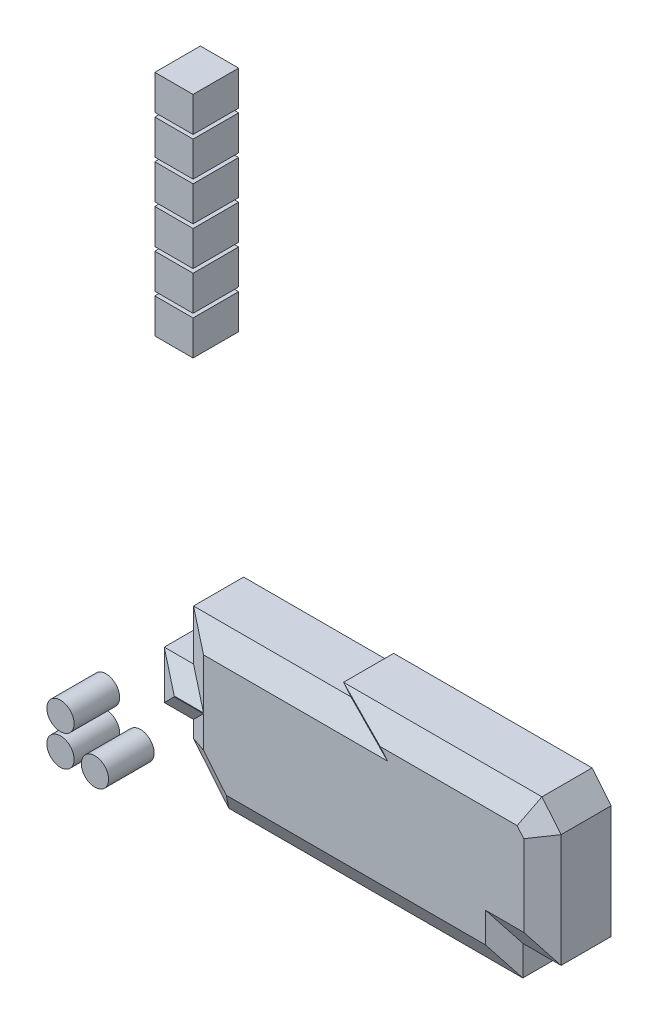
from build123d import *

# Parameters (mm, degrees)
EXTRUDE_1_DEPTH   = 14
SKETCH_2_R        = 3
EXTRUDE_2_DEPTH   = 10
EXTRUDE_2_2_DEPTH = 10
EXTRUDE_2_3_DEPTH = 10
SKETCH_2_W        = 8.399311933
SKETCH_2_H        = 7.623990832
EXTRUDE_2_4_DEPTH = 10
EXTRUDE_2_5_DEPTH = 10
EXTRUDE_2_6_DEPTH = 10
EXTRUDE_2_7_DEPTH = 10
EXTRUDE_2_8_DEPTH = 10
EXTRUDE_2_9_DEPTH = 10


with BuildPart() as part:
    # Эскиз1 → Бобышка-Вытянуть1 (new body)
    with BuildSketch(Plane.XY):
        Polygon((-36.909889511, -38.291088482), (-36.909889511, -49.324157276), (-43.332123585, -49.324157276), (-43.332123585, -59.863208064), (-36.909889511, -59.863208064), (-36.909889511, -63.486006772), (-29.170274088, -72.87234888), (35.381411989, -72.87234888), (35.381411989, -66.285442138), (43.779718086, -66.285442138), (43.779718086, -41.419869184), (39.580565037, -36.327279317), (-3.972709406, -36.327279317), (-2.353428165, -38.291088482), align=None)
    extrude(amount=EXTRUDE_1_DEPTH)

    # Фаска1
    # the kernel refuses this chamfer: 5.196152423, 3 mm, written as the material it takes off along each edge
    with BuildSketch(Plane(origin=(-36.909889511, -49.324157276, 14), x_dir=(0, 0.0578938624026709, -0.9983227437537926), z_dir=(-1, 0, 0)), Plane(origin=(-43.332123585, -59.863208064, 14), x_dir=(0, -0.0578938624026709, -0.9983227437537926), z_dir=(1, 0, 0))) as chamfer_1_piece_1:
        with BuildLine():
            Line((3.109137869, 0), (-0.414994971, 5.361118731))
            Line((-0.414994971, 5.361118731), (-0.518743714, 5.355102224))
            ThreePointArc((-0.518743714, 5.355102224), (-0.259371857, 2.677551112), (-0.103748743, -0.006016507))
            Line((-0.103748743, -0.006016507), (0.006016507, -0.103748743))
            ThreePointArc((0.006016507, -0.103748743), (1.555374994, -0.013899696), (3.115154376, -0.103748743))
            Line((3.115154376, -0.103748743), (3.109137869, 0))
        make_face()
    extrude(amount=6.422234074, mode=Mode.SUBTRACT)
    with BuildSketch(Plane(origin=(-43.332123585, -49.324157276, 14), x_dir=(-0.0578938624026709, 0, -0.9983227437537926), z_dir=(0, -1, 0))) as chamfer_1_piece_2:
        with BuildLine():
            Line((3.109137869, 0), (-0.414994971, 5.361118731))
            Line((-0.414994971, 5.361118731), (-0.518743714, 5.355102224))
            ThreePointArc((-0.518743714, 5.355102224), (-0.259371857, 2.677551112), (-0.103748743, -0.006016507))
            Line((-0.103748743, -0.006016507), (0.006016507, -0.103748743))
            ThreePointArc((0.006016507, -0.103748743), (1.555374994, -0.013899696), (3.115154376, -0.103748743))
            Line((3.115154376, -0.103748743), (3.109137869, 0))
        make_face()
    extrude(amount=10.539050788, mode=Mode.SUBTRACT)
    with BuildSketch(Plane(origin=(-36.909889511, -59.863208064, 14), x_dir=(-0.0578938624026709, 0, -0.9983227437537926), z_dir=(0, -1, 0))) as chamfer_1_piece_3_section:
        with BuildLine():
            Line((3.109137869, 0), (-0.414994971, 5.361118731))
            Line((-0.414994971, 5.361118731), (-0.518743714, 5.355102224))
            ThreePointArc((-0.518743714, 5.355102224), (-0.259371857, 2.677551112), (-0.103748743, -0.006016507))
            Line((-0.103748743, -0.006016507), (0.006016507, -0.103748743))
            ThreePointArc((0.006016507, -0.103748743), (1.555374994, -0.013899696), (3.115154376, -0.103748743))
            Line((3.115154376, -0.103748743), (3.109137869, 0))
        make_face()
    chamfer_1_piece_3 = extrude(amount=17.06569062, mode=Mode.PRIVATE)
    chamfer_1_piece_3 = split(chamfer_1_piece_3, bisect_by=Plane(origin=(-36.310735652, -64.212640175, 13.15573984), z_dir=(0.7715393663129642, 0.6361815827492885, 0)), keep=Keep.TOP, mode=Mode.PRIVATE)
    add(chamfer_1_piece_3, mode=Mode.SUBTRACT)
    with BuildSketch(Plane(origin=(-45.462009764, -53.114286465, 14), x_dir=(-0.04466739391156679, -0.03683100901480082, -0.9983227437537926), z_dir=(0.6361815827492885, -0.7715393663129642, 0))) as chamfer_1_piece_4_section:
        with BuildLine():
            Line((3.109137869, 0), (-0.414994971, 5.361118731))
            Line((-0.414994971, 5.361118731), (-0.518743714, 5.355102224))
            ThreePointArc((-0.518743714, 5.355102224), (-0.259371857, 2.677551112), (-0.103748743, -0.006016507))
            Line((-0.103748743, -0.006016507), (0.006016507, -0.103748743))
            ThreePointArc((0.006016507, -0.103748743), (1.555374994, -0.013899696), (3.115154376, -0.103748743))
            Line((3.115154376, -0.103748743), (3.109137869, 0))
        make_face()
    chamfer_1_piece_4 = extrude(amount=39.051517055, mode=Mode.PRIVATE)
    chamfer_1_piece_4 = split(chamfer_1_piece_4, bisect_by=Plane(origin=(-36.909889511, -66.628217191, 13.110188551), z_dir=(1, 0, 0)), keep=Keep.TOP, mode=Mode.PRIVATE)
    chamfer_1_piece_4 = split(chamfer_1_piece_4, bisect_by=Plane(origin=(-31.761219521, -72.87234888, 13.110188551), z_dir=(0, 1, 0)), keep=Keep.TOP, mode=Mode.PRIVATE)
    add(chamfer_1_piece_4, mode=Mode.SUBTRACT)
    with BuildSketch(Plane(origin=(-42.613166, -72.87234888, 14), x_dir=(0, -0.05789386240267318, -0.9983227437537925), z_dir=(1, 0, 0))) as chamfer_1_piece_5_section:
        with BuildLine():
            Line((3.109137869, 0), (-0.414994971, 5.361118731))
            Line((-0.414994971, 5.361118731), (-0.518743714, 5.355102224))
            ThreePointArc((-0.518743714, 5.355102224), (-0.259371857, 2.677551112), (-0.103748743, -0.006016507))
            Line((-0.103748743, -0.006016507), (0.006016507, -0.103748743))
            ThreePointArc((0.006016507, -0.103748743), (1.555374994, -0.013899696), (3.115154376, -0.103748743))
            Line((3.115154376, -0.103748743), (3.109137869, 0))
        make_face()
    chamfer_1_piece_5 = extrude(amount=77.994577989, mode=Mode.PRIVATE)
    chamfer_1_piece_5 = split(chamfer_1_piece_5, bisect_by=Plane(origin=(-17.2681662, -87.306820149, 13.044949629), z_dir=(0.7715393663129642, 0.6361815827492885, 0)), keep=Keep.TOP, mode=Mode.PRIVATE)
    add(chamfer_1_piece_5, mode=Mode.SUBTRACT)
    with BuildSketch(Plane(origin=(35.381411989, -72.87234888, 14), x_dir=(0.0578938624026709, 0, -0.9983227437537926), z_dir=(0, 1, 0))) as chamfer_1_piece_6:
        with BuildLine():
            Line((3.109137869, 0), (-0.414994971, 5.361118731))
            Line((-0.414994971, 5.361118731), (-0.518743714, 5.355102224))
            ThreePointArc((-0.518743714, 5.355102224), (-0.259371857, 2.677551112), (-0.103748743, -0.006016507))
            Line((-0.103748743, -0.006016507), (0.006016507, -0.103748743))
            ThreePointArc((0.006016507, -0.103748743), (1.555374994, -0.013899696), (3.115154376, -0.103748743))
            Line((3.115154376, -0.103748743), (3.109137869, 0))
        make_face()
    extrude(amount=6.586906743, mode=Mode.SUBTRACT)
    with BuildSketch(Plane(origin=(35.381411989, -66.285442138, 14), x_dir=(0, -0.05789386240267318, -0.9983227437537925), z_dir=(1, 0, 0))) as chamfer_1_piece_7:
        with BuildLine():
            Line((3.109137869, 0), (-0.414994971, 5.361118731))
            Line((-0.414994971, 5.361118731), (-0.518743714, 5.355102224))
            ThreePointArc((-0.518743714, 5.355102224), (-0.259371857, 2.677551112), (-0.103748743, -0.006016507))
            Line((-0.103748743, -0.006016507), (0.006016507, -0.103748743))
            ThreePointArc((0.006016507, -0.103748743), (1.555374994, -0.013899696), (3.115154376, -0.103748743))
            Line((3.115154376, -0.103748743), (3.109137869, 0))
        make_face()
    extrude(amount=8.398306097, mode=Mode.SUBTRACT)
    with BuildSketch(Plane(origin=(43.779718086, -66.285442138, 14), x_dir=(0.0578938624026709, 0, -0.9983227437537926), z_dir=(0, 1, 0))) as chamfer_1_piece_8_section:
        with BuildLine():
            Line((3.109137869, 0), (-0.414994971, 5.361118731))
            Line((-0.414994971, 5.361118731), (-0.518743714, 5.355102224))
            ThreePointArc((-0.518743714, 5.355102224), (-0.259371857, 2.677551112), (-0.103748743, -0.006016507))
            Line((-0.103748743, -0.006016507), (0.006016507, -0.103748743))
            ThreePointArc((0.006016507, -0.103748743), (1.555374994, -0.013899696), (3.115154376, -0.103748743))
            Line((3.115154376, -0.103748743), (3.109137869, 0))
        make_face()
    chamfer_1_piece_8 = extrude(amount=38.308464865, mode=Mode.PRIVATE)
    chamfer_1_piece_8 = split(chamfer_1_piece_8, bisect_by=Plane(origin=(48.602023871, -47.268197478, 13.0630262), z_dir=(-0.7715393663129643, -0.6361815827492884, 0)), keep=Keep.TOP, mode=Mode.PRIVATE)
    add(chamfer_1_piece_8, mode=Mode.SUBTRACT)
    with BuildSketch(Plane(origin=(52.331838339, -51.791589491, 14), x_dir=(0.04466739391156704, 0.036831009014801006, -0.9983227437537926), z_dir=(-0.6361815827492884, 0.7715393663129643, 0))) as chamfer_1_piece_9_section:
        with BuildLine():
            Line((3.109137869, 0), (-0.414994971, 5.361118731))
            Line((-0.414994971, 5.361118731), (-0.518743714, 5.355102224))
            ThreePointArc((-0.518743714, 5.355102224), (-0.259371857, 2.677551112), (-0.103748743, -0.006016507))
            Line((-0.103748743, -0.006016507), (0.006016507, -0.103748743))
            ThreePointArc((0.006016507, -0.103748743), (1.555374994, -0.013899696), (3.115154376, -0.103748743))
            Line((3.115154376, -0.103748743), (3.109137869, 0))
        make_face()
    chamfer_1_piece_9 = extrude(amount=33.486341215, mode=Mode.PRIVATE)
    chamfer_1_piece_9 = split(chamfer_1_piece_9, bisect_by=Plane(origin=(43.779718086, -40.523934217, 13.149770443), z_dir=(-1, 0, 0)), keep=Keep.TOP, mode=Mode.PRIVATE)
    chamfer_1_piece_9 = split(chamfer_1_piece_9, bisect_by=Plane(origin=(40.319318432, -36.327279317, 13.149770443), z_dir=(0, -1, 0)), keep=Keep.TOP, mode=Mode.PRIVATE)
    add(chamfer_1_piece_9, mode=Mode.SUBTRACT)
    with BuildSketch(Plane(origin=(11.089463747, -38.291088482, 14), x_dir=(0, 0.0578938624026709, -0.9983227437537926), z_dir=(-1, 0, 0))) as chamfer_1_piece_10_section:
        with BuildLine():
            Line((3.109137869, 0), (-0.414994971, 5.361118731))
            Line((-0.414994971, 5.361118731), (-0.518743714, 5.355102224))
            ThreePointArc((-0.518743714, 5.355102224), (-0.259371857, 2.677551112), (-0.103748743, -0.006016507))
            Line((-0.103748743, -0.006016507), (0.006016507, -0.103748743))
            ThreePointArc((0.006016507, -0.103748743), (1.555374994, -0.013899696), (3.115154376, -0.103748743))
            Line((3.115154376, -0.103748743), (3.109137869, 0))
        make_face()
    chamfer_1_piece_10 = extrude(amount=47.999353257, mode=Mode.PRIVATE)
    chamfer_1_piece_10 = split(chamfer_1_piece_10, bisect_by=Plane(origin=(-8.173409607, -31.232813116, 13.050749195), z_dir=(-0.7715393663129635, -0.6361815827492894, 0)), keep=Keep.TOP, mode=Mode.PRIVATE)
    add(chamfer_1_piece_10, mode=Mode.SUBTRACT)
    with BuildSketch(Plane(origin=(53.023456949, -36.327279317, 14), x_dir=(0, 0.0578938624026709, -0.9983227437537926), z_dir=(-1, 0, 0))) as chamfer_1_piece_11_section:
        with BuildLine():
            Line((3.109137869, 0), (-0.414994971, 5.361118731))
            Line((-0.414994971, 5.361118731), (-0.518743714, 5.355102224))
            ThreePointArc((-0.518743714, 5.355102224), (-0.259371857, 2.677551112), (-0.103748743, -0.006016507))
            Line((-0.103748743, -0.006016507), (0.006016507, -0.103748743))
            ThreePointArc((0.006016507, -0.103748743), (1.555374994, -0.013899696), (3.115154376, -0.103748743))
            Line((3.115154376, -0.103748743), (3.109137869, 0))
        make_face()
    chamfer_1_piece_11 = extrude(amount=70.439058267, mode=Mode.PRIVATE)
    chamfer_1_piece_11 = split(chamfer_1_piece_11, bisect_by=Plane(origin=(32.203932865, -27.381150939, 13.037990314), z_dir=(-0.7715393663129643, -0.6361815827492884, 0)), keep=Keep.TOP, mode=Mode.PRIVATE)
    chamfer_1_piece_11 = split(chamfer_1_piece_11, bisect_by=Plane(origin=(6.277844799, -48.758802502, 13.037990314), z_dir=(0.7715393663129635, 0.6361815827492894, 0)), keep=Keep.TOP, mode=Mode.PRIVATE)
    add(chamfer_1_piece_11, mode=Mode.SUBTRACT)
    with BuildSketch(Plane(origin=(-12.524829659, -25.95555901, 14), x_dir=(-0.04466739391156709, -0.03683100901480115, -0.9983227437537926), z_dir=(0.6361815827492894, -0.7715393663129635, 0))) as chamfer_1_piece_12_section:
        with BuildLine():
            Line((3.109137869, 0), (-0.414994971, 5.361118731))
            Line((-0.414994971, 5.361118731), (-0.518743714, 5.355102224))
            ThreePointArc((-0.518743714, 5.355102224), (-0.259371857, 2.677551112), (-0.103748743, -0.006016507))
            Line((-0.103748743, -0.006016507), (0.006016507, -0.103748743))
            ThreePointArc((0.006016507, -0.103748743), (1.555374994, -0.013899696), (3.115154376, -0.103748743))
            Line((3.115154376, -0.103748743), (3.109137869, 0))
        make_face()
    chamfer_1_piece_12 = extrude(amount=29.431096805, mode=Mode.PRIVATE)
    chamfer_1_piece_12 = split(chamfer_1_piece_12, bisect_by=Plane(origin=(-6.345177041, -38.291088482, 13.06885324), z_dir=(0, 1, 0)), keep=Keep.TOP, mode=Mode.PRIVATE)
    add(chamfer_1_piece_12, mode=Mode.SUBTRACT)
    with BuildSketch(Plane(origin=(-36.909889511, -38.291088482, 14), x_dir=(-0.0578938624026709, 0, -0.9983227437537926), z_dir=(0, -1, 0))) as chamfer_1_piece_13:
        with BuildLine():
            Line((3.109137869, 0), (-0.414994971, 5.361118731))
            Line((-0.414994971, 5.361118731), (-0.518743714, 5.355102224))
            ThreePointArc((-0.518743714, 5.355102224), (-0.259371857, 2.677551112), (-0.103748743, -0.006016507))
            Line((-0.103748743, -0.006016507), (0.006016507, -0.103748743))
            ThreePointArc((0.006016507, -0.103748743), (1.555374994, -0.013899696), (3.115154376, -0.103748743))
            Line((3.115154376, -0.103748743), (3.109137869, 0))
        make_face()
    extrude(amount=11.033068794, mode=Mode.SUBTRACT)
    with BuildSketch(Plane(origin=(-36.909889511, -38.291088482, 14), x_dir=(-0.0578938624026709, 0, -0.9983227437537926), z_dir=(0, -1, 0))) as chamfer_1_piece_14a_section:
        with BuildLine():
            Line((3.109137869, 0), (-0.414994971, 5.361118731))
            Line((-0.414994971, 5.361118731), (-0.518743714, 5.355102224))
            ThreePointArc((-0.518743714, 5.355102224), (-0.259371857, 2.677551112), (-0.103748743, -0.006016507))
            Line((-0.103748743, -0.006016507), (0.006016507, -0.103748743))
            ThreePointArc((0.006016507, -0.103748743), (1.555374994, -0.013899696), (3.115154376, -0.103748743))
            Line((3.115154376, -0.103748743), (3.109137869, 0))
        make_face()
    chamfer_1_piece_14a = extrude(amount=24.475960706, mode=Mode.PRIVATE)
    chamfer_1_piece_14a = split(chamfer_1_piece_14a, bisect_by=Plane(origin=(-35.167192108, -49.324157276, 13.037990314), z_dir=(0, -1, 0)), keep=Keep.TOP, mode=Mode.PRIVATE)
    with BuildSketch(Plane(origin=(-23.466997599, -49.324157276, 14), x_dir=(0, 0.0578938624026709, -0.9983227437537926), z_dir=(-1, 0, 0))) as chamfer_1_piece_14b_section:
        with BuildLine():
            Line((3.109137869, 0), (-0.414994971, 5.361118731))
            Line((-0.414994971, 5.361118731), (-0.518743714, 5.355102224))
            ThreePointArc((-0.518743714, 5.355102224), (-0.259371857, 2.677551112), (-0.103748743, -0.006016507))
            Line((-0.103748743, -0.006016507), (0.006016507, -0.103748743))
            ThreePointArc((0.006016507, -0.103748743), (1.555374994, -0.013899696), (3.115154376, -0.103748743))
            Line((3.115154376, -0.103748743), (3.109137869, 0))
        make_face()
    chamfer_1_piece_14b = extrude(amount=19.865125986, mode=Mode.PRIVATE)
    chamfer_1_piece_14b = split(chamfer_1_piece_14b, bisect_by=Plane(origin=(-36.909889511, -51.066854679, 13.037990314), z_dir=(1, 0, 0)), keep=Keep.TOP, mode=Mode.PRIVATE)
    chamfer_1_piece_14 = chamfer_1_piece_14a & chamfer_1_piece_14b
    add(chamfer_1_piece_14, mode=Mode.SUBTRACT)
    with BuildSketch(Plane(origin=(-36.909889511, -49.324157276, 14), x_dir=(0, 0.0578938624026709, -0.9983227437537926), z_dir=(-1, 0, 0))) as chamfer_1_piece_15a_section:
        with BuildLine():
            Line((3.109137869, 0), (-0.414994971, 5.361118731))
            Line((-0.414994971, 5.361118731), (-0.518743714, 5.355102224))
            ThreePointArc((-0.518743714, 5.355102224), (-0.259371857, 2.677551112), (-0.103748743, -0.006016507))
            Line((-0.103748743, -0.006016507), (0.006016507, -0.103748743))
            ThreePointArc((0.006016507, -0.103748743), (1.555374994, -0.013899696), (3.115154376, -0.103748743))
            Line((3.115154376, -0.103748743), (3.109137869, 0))
        make_face()
    chamfer_1_piece_15a = extrude(amount=19.865125986, mode=Mode.PRIVATE)
    chamfer_1_piece_15a = split(chamfer_1_piece_15a, bisect_by=Plane(origin=(-43.332123585, -51.066854679, 13.037990314), z_dir=(-1, 0, 0)), keep=Keep.TOP, mode=Mode.PRIVATE)
    with BuildSketch(Plane(origin=(-43.332123585, -35.881265364, 14), x_dir=(-0.0578938624026709, 0, -0.9983227437537926), z_dir=(0, -1, 0))) as chamfer_1_piece_15b_section:
        with BuildLine():
            Line((3.109137869, 0), (-0.414994971, 5.361118731))
            Line((-0.414994971, 5.361118731), (-0.518743714, 5.355102224))
            ThreePointArc((-0.518743714, 5.355102224), (-0.259371857, 2.677551112), (-0.103748743, -0.006016507))
            Line((-0.103748743, -0.006016507), (0.006016507, -0.103748743))
            ThreePointArc((0.006016507, -0.103748743), (1.555374994, -0.013899696), (3.115154376, -0.103748743))
            Line((3.115154376, -0.103748743), (3.109137869, 0))
        make_face()
    chamfer_1_piece_15b = extrude(amount=23.9819427, mode=Mode.PRIVATE)
    chamfer_1_piece_15b = split(chamfer_1_piece_15b, bisect_by=Plane(origin=(-41.589426182, -49.324157276, 13.037990314), z_dir=(0, 1, 0)), keep=Keep.TOP, mode=Mode.PRIVATE)
    chamfer_1_piece_15 = chamfer_1_piece_15a & chamfer_1_piece_15b
    add(chamfer_1_piece_15, mode=Mode.SUBTRACT)
    with BuildSketch(Plane(origin=(-43.332123585, -49.324157276, 14), x_dir=(-0.0578938624026709, 0, -0.9983227437537926), z_dir=(0, -1, 0))) as chamfer_1_piece_16a_section:
        with BuildLine():
            Line((3.109137869, 0), (-0.414994971, 5.361118731))
            Line((-0.414994971, 5.361118731), (-0.518743714, 5.355102224))
            ThreePointArc((-0.518743714, 5.355102224), (-0.259371857, 2.677551112), (-0.103748743, -0.006016507))
            Line((-0.103748743, -0.006016507), (0.006016507, -0.103748743))
            ThreePointArc((0.006016507, -0.103748743), (1.555374994, -0.013899696), (3.115154376, -0.103748743))
            Line((3.115154376, -0.103748743), (3.109137869, 0))
        make_face()
    chamfer_1_piece_16a = extrude(amount=23.9819427, mode=Mode.PRIVATE)
    chamfer_1_piece_16a = split(chamfer_1_piece_16a, bisect_by=Plane(origin=(-41.589426182, -59.863208064, 13.037990314), z_dir=(0, -1, 0)), keep=Keep.TOP, mode=Mode.PRIVATE)
    with BuildSketch(Plane(origin=(-56.775015497, -59.863208064, 14), x_dir=(0, -0.0578938624026709, -0.9983227437537926), z_dir=(1, 0, 0))) as chamfer_1_piece_16b_section:
        with BuildLine():
            Line((3.109137869, 0), (-0.414994971, 5.361118731))
            Line((-0.414994971, 5.361118731), (-0.518743714, 5.355102224))
            ThreePointArc((-0.518743714, 5.355102224), (-0.259371857, 2.677551112), (-0.103748743, -0.006016507))
            Line((-0.103748743, -0.006016507), (0.006016507, -0.103748743))
            ThreePointArc((0.006016507, -0.103748743), (1.555374994, -0.013899696), (3.115154376, -0.103748743))
            Line((3.115154376, -0.103748743), (3.109137869, 0))
        make_face()
    chamfer_1_piece_16b = extrude(amount=19.865125986, mode=Mode.PRIVATE)
    chamfer_1_piece_16b = split(chamfer_1_piece_16b, bisect_by=Plane(origin=(-43.332123585, -58.120510661, 13.037990314), z_dir=(-1, 0, 0)), keep=Keep.TOP, mode=Mode.PRIVATE)
    chamfer_1_piece_16 = chamfer_1_piece_16a & chamfer_1_piece_16b
    add(chamfer_1_piece_16, mode=Mode.SUBTRACT)
    with BuildSketch(Plane(origin=(-43.332123585, -59.863208064, 14), x_dir=(0, -0.0578938624026709, -0.9983227437537926), z_dir=(1, 0, 0))) as chamfer_1_piece_17a_section:
        with BuildLine():
            Line((3.109137869, 0), (-0.414994971, 5.361118731))
            Line((-0.414994971, 5.361118731), (-0.518743714, 5.355102224))
            ThreePointArc((-0.518743714, 5.355102224), (-0.259371857, 2.677551112), (-0.103748743, -0.006016507))
            Line((-0.103748743, -0.006016507), (0.006016507, -0.103748743))
            ThreePointArc((0.006016507, -0.103748743), (1.555374994, -0.013899696), (3.115154376, -0.103748743))
            Line((3.115154376, -0.103748743), (3.109137869, 0))
        make_face()
    chamfer_1_piece_17a = extrude(amount=19.865125986, mode=Mode.PRIVATE)
    chamfer_1_piece_17a = split(chamfer_1_piece_17a, bisect_by=Plane(origin=(-36.909889511, -58.120510661, 13.037990314), z_dir=(1, 0, 0)), keep=Keep.TOP, mode=Mode.PRIVATE)
    with BuildSketch(Plane(origin=(-36.909889511, -46.420316152, 14), x_dir=(-0.0578938624026709, 0, -0.9983227437537926), z_dir=(0, -1, 0))) as chamfer_1_piece_17b_section:
        with BuildLine():
            Line((3.109137869, 0), (-0.414994971, 5.361118731))
            Line((-0.414994971, 5.361118731), (-0.518743714, 5.355102224))
            ThreePointArc((-0.518743714, 5.355102224), (-0.259371857, 2.677551112), (-0.103748743, -0.006016507))
            Line((-0.103748743, -0.006016507), (0.006016507, -0.103748743))
            ThreePointArc((0.006016507, -0.103748743), (1.555374994, -0.013899696), (3.115154376, -0.103748743))
            Line((3.115154376, -0.103748743), (3.109137869, 0))
        make_face()
    chamfer_1_piece_17b = extrude(amount=30.508582532, mode=Mode.PRIVATE)
    chamfer_1_piece_17b = split(chamfer_1_piece_17b, bisect_by=Plane(origin=(-35.167192108, -59.863208064, 13.037990314), z_dir=(0, 1, 0)), keep=Keep.TOP, mode=Mode.PRIVATE)
    chamfer_1_piece_17 = chamfer_1_piece_17a & chamfer_1_piece_17b
    add(chamfer_1_piece_17, mode=Mode.SUBTRACT)
    with BuildSketch(Plane(origin=(-36.909889511, -59.863208064, 14), x_dir=(-0.0578938624026709, 0, -0.9983227437537926), z_dir=(0, -1, 0))) as chamfer_1_piece_18a_section:
        with BuildLine():
            Line((3.109137869, 0), (-0.414994971, 5.361118731))
            Line((-0.414994971, 5.361118731), (-0.518743714, 5.355102224))
            ThreePointArc((-0.518743714, 5.355102224), (-0.259371857, 2.677551112), (-0.103748743, -0.006016507))
            Line((-0.103748743, -0.006016507), (0.006016507, -0.103748743))
            ThreePointArc((0.006016507, -0.103748743), (1.555374994, -0.013899696), (3.115154376, -0.103748743))
            Line((3.115154376, -0.103748743), (3.109137869, 0))
        make_face()
    chamfer_1_piece_18a = extrude(amount=17.06569062, mode=Mode.PRIVATE)
    chamfer_1_piece_18a = split(chamfer_1_piece_18a, bisect_by=Plane(origin=(-32.520529526, -68.809273136, 12.978371613), z_dir=(-0.7715393663129642, -0.6361815827492885, 0)), keep=Keep.TOP, mode=Mode.PRIVATE)
    with BuildSketch(Plane(origin=(-45.462009764, -53.114286465, 14), x_dir=(-0.04466739391156679, -0.03683100901480082, -0.9983227437537926), z_dir=(0.6361815827492885, -0.7715393663129642, 0))) as chamfer_1_piece_18b_section:
        with BuildLine():
            Line((3.109137869, 0), (-0.414994971, 5.361118731))
            Line((-0.414994971, 5.361118731), (-0.518743714, 5.355102224))
            ThreePointArc((-0.518743714, 5.355102224), (-0.259371857, 2.677551112), (-0.103748743, -0.006016507))
            Line((-0.103748743, -0.006016507), (0.006016507, -0.103748743))
            ThreePointArc((0.006016507, -0.103748743), (1.555374994, -0.013899696), (3.115154376, -0.103748743))
            Line((3.115154376, -0.103748743), (3.109137869, 0))
        make_face()
    chamfer_1_piece_18b = extrude(amount=39.051517055, mode=Mode.PRIVATE)
    chamfer_1_piece_18b = split(chamfer_1_piece_18b, bisect_by=Plane(origin=(-36.909889511, -56.586467233, 12.978371613), z_dir=(-1, 0, 0)), keep=Keep.TOP, mode=Mode.PRIVATE)
    chamfer_1_piece_18 = chamfer_1_piece_18a & chamfer_1_piece_18b
    add(chamfer_1_piece_18, mode=Mode.SUBTRACT)
    with BuildSketch(Plane(origin=(-45.462009764, -53.114286465, 14), x_dir=(-0.04466739391156679, -0.03683100901480082, -0.9983227437537926), z_dir=(0.6361815827492885, -0.7715393663129642, 0))) as chamfer_1_piece_19a_section:
        with BuildLine():
            Line((3.109137869, 0), (-0.414994971, 5.361118731))
            Line((-0.414994971, 5.361118731), (-0.518743714, 5.355102224))
            ThreePointArc((-0.518743714, 5.355102224), (-0.259371857, 2.677551112), (-0.103748743, -0.006016507))
            Line((-0.103748743, -0.006016507), (0.006016507, -0.103748743))
            ThreePointArc((0.006016507, -0.103748743), (1.555374994, -0.013899696), (3.115154376, -0.103748743))
            Line((3.115154376, -0.103748743), (3.109137869, 0))
        make_face()
    chamfer_1_piece_19a = extrude(amount=39.051517055, mode=Mode.PRIVATE)
    chamfer_1_piece_19a = split(chamfer_1_piece_19a, bisect_by=Plane(origin=(-23.218923028, -72.87234888, 12.999739571), z_dir=(0, -1, 0)), keep=Keep.TOP, mode=Mode.PRIVATE)
    with BuildSketch(Plane(origin=(-42.613166, -72.87234888, 14), x_dir=(0, -0.05789386240267318, -0.9983227437537925), z_dir=(1, 0, 0))) as chamfer_1_piece_19b_section:
        with BuildLine():
            Line((3.109137869, 0), (-0.414994971, 5.361118731))
            Line((-0.414994971, 5.361118731), (-0.518743714, 5.355102224))
            ThreePointArc((-0.518743714, 5.355102224), (-0.259371857, 2.677551112), (-0.103748743, -0.006016507))
            Line((-0.103748743, -0.006016507), (0.006016507, -0.103748743))
            ThreePointArc((0.006016507, -0.103748743), (1.555374994, -0.013899696), (3.115154376, -0.103748743))
            Line((3.115154376, -0.103748743), (3.109137869, 0))
        make_face()
    chamfer_1_piece_19b = extrude(amount=77.994577989, mode=Mode.PRIVATE)
    chamfer_1_piece_19b = split(chamfer_1_piece_19b, bisect_by=Plane(origin=(-32.956414026, -68.280647254, 12.999739571), z_dir=(-0.7715393663129642, -0.6361815827492885, 0)), keep=Keep.TOP, mode=Mode.PRIVATE)
    chamfer_1_piece_19 = chamfer_1_piece_19a & chamfer_1_piece_19b
    add(chamfer_1_piece_19, mode=Mode.SUBTRACT)
    with BuildSketch(Plane(origin=(-42.613166, -72.87234888, 14), x_dir=(0, -0.05789386240267318, -0.9983227437537925), z_dir=(1, 0, 0))) as chamfer_1_piece_20a_section:
        with BuildLine():
            Line((3.109137869, 0), (-0.414994971, 5.361118731))
            Line((-0.414994971, 5.361118731), (-0.518743714, 5.355102224))
            ThreePointArc((-0.518743714, 5.355102224), (-0.259371857, 2.677551112), (-0.103748743, -0.006016507))
            Line((-0.103748743, -0.006016507), (0.006016507, -0.103748743))
            ThreePointArc((0.006016507, -0.103748743), (1.555374994, -0.013899696), (3.115154376, -0.103748743))
            Line((3.115154376, -0.103748743), (3.109137869, 0))
        make_face()
    chamfer_1_piece_20a = extrude(amount=91.437469901, mode=Mode.PRIVATE)
    chamfer_1_piece_20a = split(chamfer_1_piece_20a, bisect_by=Plane(origin=(35.381411989, -71.129651477, 13.037990314), z_dir=(1, 0, 0)), keep=Keep.TOP, mode=Mode.PRIVATE)
    with BuildSketch(Plane(origin=(35.381411989, -86.315240792, 14), x_dir=(0.0578938624026709, 0, -0.9983227437537926), z_dir=(0, 1, 0))) as chamfer_1_piece_20b_section:
        with BuildLine():
            Line((3.109137869, 0), (-0.414994971, 5.361118731))
            Line((-0.414994971, 5.361118731), (-0.518743714, 5.355102224))
            ThreePointArc((-0.518743714, 5.355102224), (-0.259371857, 2.677551112), (-0.103748743, -0.006016507))
            Line((-0.103748743, -0.006016507), (0.006016507, -0.103748743))
            ThreePointArc((0.006016507, -0.103748743), (1.555374994, -0.013899696), (3.115154376, -0.103748743))
            Line((3.115154376, -0.103748743), (3.109137869, 0))
        make_face()
    chamfer_1_piece_20b = extrude(amount=20.029798654, mode=Mode.PRIVATE)
    chamfer_1_piece_20b = split(chamfer_1_piece_20b, bisect_by=Plane(origin=(33.638714586, -72.87234888, 13.037990314), z_dir=(0, -1, 0)), keep=Keep.TOP, mode=Mode.PRIVATE)
    chamfer_1_piece_20 = chamfer_1_piece_20a & chamfer_1_piece_20b
    add(chamfer_1_piece_20, mode=Mode.SUBTRACT)
    with BuildSketch(Plane(origin=(35.381411989, -72.87234888, 14), x_dir=(0.0578938624026709, 0, -0.9983227437537926), z_dir=(0, 1, 0))) as chamfer_1_piece_21a_section:
        with BuildLine():
            Line((3.109137869, 0), (-0.414994971, 5.361118731))
            Line((-0.414994971, 5.361118731), (-0.518743714, 5.355102224))
            ThreePointArc((-0.518743714, 5.355102224), (-0.259371857, 2.677551112), (-0.103748743, -0.006016507))
            Line((-0.103748743, -0.006016507), (0.006016507, -0.103748743))
            ThreePointArc((0.006016507, -0.103748743), (1.555374994, -0.013899696), (3.115154376, -0.103748743))
            Line((3.115154376, -0.103748743), (3.109137869, 0))
        make_face()
    chamfer_1_piece_21a = extrude(amount=20.029798654, mode=Mode.PRIVATE)
    chamfer_1_piece_21a = split(chamfer_1_piece_21a, bisect_by=Plane(origin=(33.638714586, -66.285442138, 13.037990314), z_dir=(0, 1, 0)), keep=Keep.TOP, mode=Mode.PRIVATE)
    with BuildSketch(Plane(origin=(21.938520077, -66.285442138, 14), x_dir=(0, -0.05789386240267318, -0.9983227437537925), z_dir=(1, 0, 0))) as chamfer_1_piece_21b_section:
        with BuildLine():
            Line((3.109137869, 0), (-0.414994971, 5.361118731))
            Line((-0.414994971, 5.361118731), (-0.518743714, 5.355102224))
            ThreePointArc((-0.518743714, 5.355102224), (-0.259371857, 2.677551112), (-0.103748743, -0.006016507))
            Line((-0.103748743, -0.006016507), (0.006016507, -0.103748743))
            ThreePointArc((0.006016507, -0.103748743), (1.555374994, -0.013899696), (3.115154376, -0.103748743))
            Line((3.115154376, -0.103748743), (3.109137869, 0))
        make_face()
    chamfer_1_piece_21b = extrude(amount=21.841198009, mode=Mode.PRIVATE)
    chamfer_1_piece_21b = split(chamfer_1_piece_21b, bisect_by=Plane(origin=(35.381411989, -64.542744735, 13.037990314), z_dir=(-1, 0, 0)), keep=Keep.TOP, mode=Mode.PRIVATE)
    chamfer_1_piece_21 = chamfer_1_piece_21a & chamfer_1_piece_21b
    add(chamfer_1_piece_21, mode=Mode.SUBTRACT)
    with BuildSketch(Plane(origin=(35.381411989, -66.285442138, 14), x_dir=(0, -0.05789386240267318, -0.9983227437537925), z_dir=(1, 0, 0))) as chamfer_1_piece_22a_section:
        with BuildLine():
            Line((3.109137869, 0), (-0.414994971, 5.361118731))
            Line((-0.414994971, 5.361118731), (-0.518743714, 5.355102224))
            ThreePointArc((-0.518743714, 5.355102224), (-0.259371857, 2.677551112), (-0.103748743, -0.006016507))
            Line((-0.103748743, -0.006016507), (0.006016507, -0.103748743))
            ThreePointArc((0.006016507, -0.103748743), (1.555374994, -0.013899696), (3.115154376, -0.103748743))
            Line((3.115154376, -0.103748743), (3.109137869, 0))
        make_face()
    chamfer_1_piece_22a = extrude(amount=21.841198009, mode=Mode.PRIVATE)
    chamfer_1_piece_22a = split(chamfer_1_piece_22a, bisect_by=Plane(origin=(43.779718086, -64.542744735, 13.037990314), z_dir=(1, 0, 0)), keep=Keep.TOP, mode=Mode.PRIVATE)
    with BuildSketch(Plane(origin=(43.779718086, -79.728334049, 14), x_dir=(0.0578938624026709, 0, -0.9983227437537926), z_dir=(0, 1, 0))) as chamfer_1_piece_22b_section:
        with BuildLine():
            Line((3.109137869, 0), (-0.414994971, 5.361118731))
            Line((-0.414994971, 5.361118731), (-0.518743714, 5.355102224))
            ThreePointArc((-0.518743714, 5.355102224), (-0.259371857, 2.677551112), (-0.103748743, -0.006016507))
            Line((-0.103748743, -0.006016507), (0.006016507, -0.103748743))
            ThreePointArc((0.006016507, -0.103748743), (1.555374994, -0.013899696), (3.115154376, -0.103748743))
            Line((3.115154376, -0.103748743), (3.109137869, 0))
        make_face()
    chamfer_1_piece_22b = extrude(amount=51.751356777, mode=Mode.PRIVATE)
    chamfer_1_piece_22b = split(chamfer_1_piece_22b, bisect_by=Plane(origin=(42.037020683, -66.285442138, 13.037990314), z_dir=(0, -1, 0)), keep=Keep.TOP, mode=Mode.PRIVATE)
    chamfer_1_piece_22 = chamfer_1_piece_22a & chamfer_1_piece_22b
    add(chamfer_1_piece_22, mode=Mode.SUBTRACT)
    with BuildSketch(Plane(origin=(43.779718086, -66.285442138, 14), x_dir=(0.0578938624026709, 0, -0.9983227437537926), z_dir=(0, 1, 0))) as chamfer_1_piece_23a_section:
        with BuildLine():
            Line((3.109137869, 0), (-0.414994971, 5.361118731))
            Line((-0.414994971, 5.361118731), (-0.518743714, 5.355102224))
            ThreePointArc((-0.518743714, 5.355102224), (-0.259371857, 2.677551112), (-0.103748743, -0.006016507))
            Line((-0.103748743, -0.006016507), (0.006016507, -0.103748743))
            ThreePointArc((0.006016507, -0.103748743), (1.555374994, -0.013899696), (3.115154376, -0.103748743))
            Line((3.115154376, -0.103748743), (3.109137869, 0))
        make_face()
    chamfer_1_piece_23a = extrude(amount=38.308464865, mode=Mode.PRIVATE)
    chamfer_1_piece_23a = split(chamfer_1_piece_23a, bisect_by=Plane(origin=(39.390358101, -36.09660282, 12.978371613), z_dir=(0.7715393663129643, 0.6361815827492884, 0)), keep=Keep.TOP, mode=Mode.PRIVATE)
    with BuildSketch(Plane(origin=(52.331838339, -51.791589491, 14), x_dir=(0.04466739391156704, 0.036831009014801006, -0.9983227437537926), z_dir=(-0.6361815827492884, 0.7715393663129643, 0))) as chamfer_1_piece_23b_section:
        with BuildLine():
            Line((3.109137869, 0), (-0.414994971, 5.361118731))
            Line((-0.414994971, 5.361118731), (-0.518743714, 5.355102224))
            ThreePointArc((-0.518743714, 5.355102224), (-0.259371857, 2.677551112), (-0.103748743, -0.006016507))
            Line((-0.103748743, -0.006016507), (0.006016507, -0.103748743))
            ThreePointArc((0.006016507, -0.103748743), (1.555374994, -0.013899696), (3.115154376, -0.103748743))
            Line((3.115154376, -0.103748743), (3.109137869, 0))
        make_face()
    chamfer_1_piece_23b = extrude(amount=33.486341215, mode=Mode.PRIVATE)
    chamfer_1_piece_23b = split(chamfer_1_piece_23b, bisect_by=Plane(origin=(43.779718086, -48.319408724, 12.978371613), z_dir=(1, 0, 0)), keep=Keep.TOP, mode=Mode.PRIVATE)
    chamfer_1_piece_23 = chamfer_1_piece_23a & chamfer_1_piece_23b
    add(chamfer_1_piece_23, mode=Mode.SUBTRACT)
    with BuildSketch(Plane(origin=(52.331838339, -51.791589491, 14), x_dir=(0.04466739391156704, 0.036831009014801006, -0.9983227437537926), z_dir=(-0.6361815827492884, 0.7715393663129643, 0))) as chamfer_1_piece_24a_section:
        with BuildLine():
            Line((3.109137869, 0), (-0.414994971, 5.361118731))
            Line((-0.414994971, 5.361118731), (-0.518743714, 5.355102224))
            ThreePointArc((-0.518743714, 5.355102224), (-0.259371857, 2.677551112), (-0.103748743, -0.006016507))
            Line((-0.103748743, -0.006016507), (0.006016507, -0.103748743))
            ThreePointArc((0.006016507, -0.103748743), (1.555374994, -0.013899696), (3.115154376, -0.103748743))
            Line((3.115154376, -0.103748743), (3.109137869, 0))
        make_face()
    chamfer_1_piece_24a = extrude(amount=33.486341215, mode=Mode.PRIVATE)
    chamfer_1_piece_24a = split(chamfer_1_piece_24a, bisect_by=Plane(origin=(33.629213977, -36.327279317, 12.999739571), z_dir=(0, 1, 0)), keep=Keep.TOP, mode=Mode.PRIVATE)
    with BuildSketch(Plane(origin=(53.023456949, -36.327279317, 14), x_dir=(0, 0.0578938624026709, -0.9983227437537926), z_dir=(-1, 0, 0))) as chamfer_1_piece_24b_section:
        with BuildLine():
            Line((3.109137869, 0), (-0.414994971, 5.361118731))
            Line((-0.414994971, 5.361118731), (-0.518743714, 5.355102224))
            ThreePointArc((-0.518743714, 5.355102224), (-0.259371857, 2.677551112), (-0.103748743, -0.006016507))
            Line((-0.103748743, -0.006016507), (0.006016507, -0.103748743))
            ThreePointArc((0.006016507, -0.103748743), (1.555374994, -0.013899696), (3.115154376, -0.103748743))
            Line((3.115154376, -0.103748743), (3.109137869, 0))
        make_face()
    chamfer_1_piece_24b = extrude(amount=70.439058267, mode=Mode.PRIVATE)
    chamfer_1_piece_24b = split(chamfer_1_piece_24b, bisect_by=Plane(origin=(43.366704975, -40.918980943, 12.999739571), z_dir=(0.7715393663129643, 0.6361815827492884, 0)), keep=Keep.TOP, mode=Mode.PRIVATE)
    chamfer_1_piece_24 = chamfer_1_piece_24a & chamfer_1_piece_24b
    add(chamfer_1_piece_24, mode=Mode.SUBTRACT)
    with BuildSketch(Plane(origin=(-12.524829659, -25.95555901, 14), x_dir=(-0.04466739391156709, -0.03683100901480115, -0.9983227437537926), z_dir=(0.6361815827492894, -0.7715393663129635, 0))) as chamfer_1_piece_25a_section:
        with BuildLine():
            Line((3.109137869, 0), (-0.414994971, 5.361118731))
            Line((-0.414994971, 5.361118731), (-0.518743714, 5.355102224))
            ThreePointArc((-0.518743714, 5.355102224), (-0.259371857, 2.677551112), (-0.103748743, -0.006016507))
            Line((-0.103748743, -0.006016507), (0.006016507, -0.103748743))
            ThreePointArc((0.006016507, -0.103748743), (1.555374994, -0.013899696), (3.115154376, -0.103748743))
            Line((3.115154376, -0.103748743), (3.109137869, 0))
        make_face()
    chamfer_1_piece_25a = extrude(amount=29.431096805, mode=Mode.PRIVATE)
    chamfer_1_piece_25a = split(chamfer_1_piece_25a, bisect_by=Plane(origin=(3.597922896, -38.291088482, 12.999739571), z_dir=(0, -1, 0)), keep=Keep.TOP, mode=Mode.PRIVATE)
    with BuildSketch(Plane(origin=(11.089463747, -38.291088482, 14), x_dir=(0, 0.0578938624026709, -0.9983227437537926), z_dir=(-1, 0, 0))) as chamfer_1_piece_25b_section:
        with BuildLine():
            Line((3.109137869, 0), (-0.414994971, 5.361118731))
            Line((-0.414994971, 5.361118731), (-0.518743714, 5.355102224))
            ThreePointArc((-0.518743714, 5.355102224), (-0.259371857, 2.677551112), (-0.103748743, -0.006016507))
            Line((-0.103748743, -0.006016507), (0.006016507, -0.103748743))
            ThreePointArc((0.006016507, -0.103748743), (1.555374994, -0.013899696), (3.115154376, -0.103748743))
            Line((3.115154376, -0.103748743), (3.109137869, 0))
        make_face()
    chamfer_1_piece_25b = extrude(amount=47.999353257, mode=Mode.PRIVATE)
    chamfer_1_piece_25b = split(chamfer_1_piece_25b, bisect_by=Plane(origin=(1.432711772, -42.882790108, 12.999739571), z_dir=(0.7715393663129635, 0.6361815827492894, 0)), keep=Keep.TOP, mode=Mode.PRIVATE)
    chamfer_1_piece_25 = chamfer_1_piece_25a & chamfer_1_piece_25b
    add(chamfer_1_piece_25, mode=Mode.SUBTRACT)
    with BuildSketch(Plane(origin=(-36.909889511, -24.84819657, 14), x_dir=(-0.0578938624026709, 0, -0.9983227437537926), z_dir=(0, -1, 0))) as chamfer_1_piece_26a_section:
        with BuildLine():
            Line((3.109137869, 0), (-0.414994971, 5.361118731))
            Line((-0.414994971, 5.361118731), (-0.518743714, 5.355102224))
            ThreePointArc((-0.518743714, 5.355102224), (-0.259371857, 2.677551112), (-0.103748743, -0.006016507))
            Line((-0.103748743, -0.006016507), (0.006016507, -0.103748743))
            ThreePointArc((0.006016507, -0.103748743), (1.555374994, -0.013899696), (3.115154376, -0.103748743))
            Line((3.115154376, -0.103748743), (3.109137869, 0))
        make_face()
    chamfer_1_piece_26a = extrude(amount=24.475960706, mode=Mode.PRIVATE)
    chamfer_1_piece_26a = split(chamfer_1_piece_26a, bisect_by=Plane(origin=(-35.167192108, -38.291088482, 13.037990314), z_dir=(0, 1, 0)), keep=Keep.TOP, mode=Mode.PRIVATE)
    with BuildSketch(Plane(origin=(11.089463747, -38.291088482, 14), x_dir=(0, 0.0578938624026709, -0.9983227437537926), z_dir=(-1, 0, 0))) as chamfer_1_piece_26b_section:
        with BuildLine():
            Line((3.109137869, 0), (-0.414994971, 5.361118731))
            Line((-0.414994971, 5.361118731), (-0.518743714, 5.355102224))
            ThreePointArc((-0.518743714, 5.355102224), (-0.259371857, 2.677551112), (-0.103748743, -0.006016507))
            Line((-0.103748743, -0.006016507), (0.006016507, -0.103748743))
            ThreePointArc((0.006016507, -0.103748743), (1.555374994, -0.013899696), (3.115154376, -0.103748743))
            Line((3.115154376, -0.103748743), (3.109137869, 0))
        make_face()
    chamfer_1_piece_26b = extrude(amount=61.442245169, mode=Mode.PRIVATE)
    chamfer_1_piece_26b = split(chamfer_1_piece_26b, bisect_by=Plane(origin=(-36.909889511, -40.033785885, 13.037990314), z_dir=(-1, 0, 0)), keep=Keep.TOP, mode=Mode.PRIVATE)
    chamfer_1_piece_26 = chamfer_1_piece_26a & chamfer_1_piece_26b
    add(chamfer_1_piece_26, mode=Mode.SUBTRACT)


with BuildPart() as body_2:
    # Эскиз2 → Бобышка-Вытянуть2 (new body)
    with BuildSketch(Plane.XY):
        with Locations((-67.123183615, -74.790238099)):
            Circle(SKETCH_2_R)
    extrude(amount=EXTRUDE_2_DEPTH)


with BuildPart() as body_3:
    # Эскиз2 → Extrude 2 2 (new body)
    with BuildSketch(Plane.XY):
        with Locations((-67.123183615, -81.585318196)):
            Circle(SKETCH_2_R)
    extrude(amount=EXTRUDE_2_2_DEPTH)


with BuildPart() as body_4:
    # Эскиз2 → Extrude 2 3 (new body)
    with BuildSketch(Plane.XY):
        with Locations((-59.555935325, -81.585318196)):
            Circle(SKETCH_2_R)
    extrude(amount=EXTRUDE_2_3_DEPTH)


with BuildPart() as body_5:
    # Эскиз2 → Extrude 2 4 (new body)
    with BuildSketch(Plane.XY):
        with Locations((-42.207965026, 45.607198889)):
            Rectangle(SKETCH_2_W, SKETCH_2_H)
    extrude(amount=EXTRUDE_2_4_DEPTH)


with BuildPart() as body_6:
    # Эскиз2 → Extrude 2 5 (new body)
    with BuildSketch(Plane.XY):
        with Locations((-42.207965026, 54.107198889)):
            Rectangle(SKETCH_2_W, SKETCH_2_H)
    extrude(amount=EXTRUDE_2_5_DEPTH)


with BuildPart() as body_7:
    # Эскиз2 → Extrude 2 6 (new body)
    with BuildSketch(Plane.XY):
        with Locations((-42.207965026, 37.107198889)):
            Rectangle(SKETCH_2_W, SKETCH_2_H)
    extrude(amount=EXTRUDE_2_6_DEPTH)


with BuildPart() as body_8:
    # Эскиз2 → Extrude 2 7 (new body)
    with BuildSketch(Plane.XY):
        with Locations((-42.207965026, 28.607198889)):
            Rectangle(SKETCH_2_W, SKETCH_2_H)
    extrude(amount=EXTRUDE_2_7_DEPTH)


with BuildPart() as body_9:
    # Эскиз2 → Extrude 2 8 (new body)
    with BuildSketch(Plane.XY):
        with Locations((-42.207965026, 20.107198889)):
            Rectangle(SKETCH_2_W, SKETCH_2_H)
    extrude(amount=EXTRUDE_2_8_DEPTH)


with BuildPart() as body_10:
    # Эскиз2 → Extrude 2 9 (new body)
    with BuildSketch(Plane.XY):
        with Locations((-42.207965026, 11.607198889)):
            Rectangle(SKETCH_2_W, SKETCH_2_H)
    extrude(amount=EXTRUDE_2_9_DEPTH)


solid = Compound([part.part, body_2.part, body_3.part, body_4.part, body_5.part, body_6.part, body_7.part, body_8.part, body_9.part, body_10.part])
